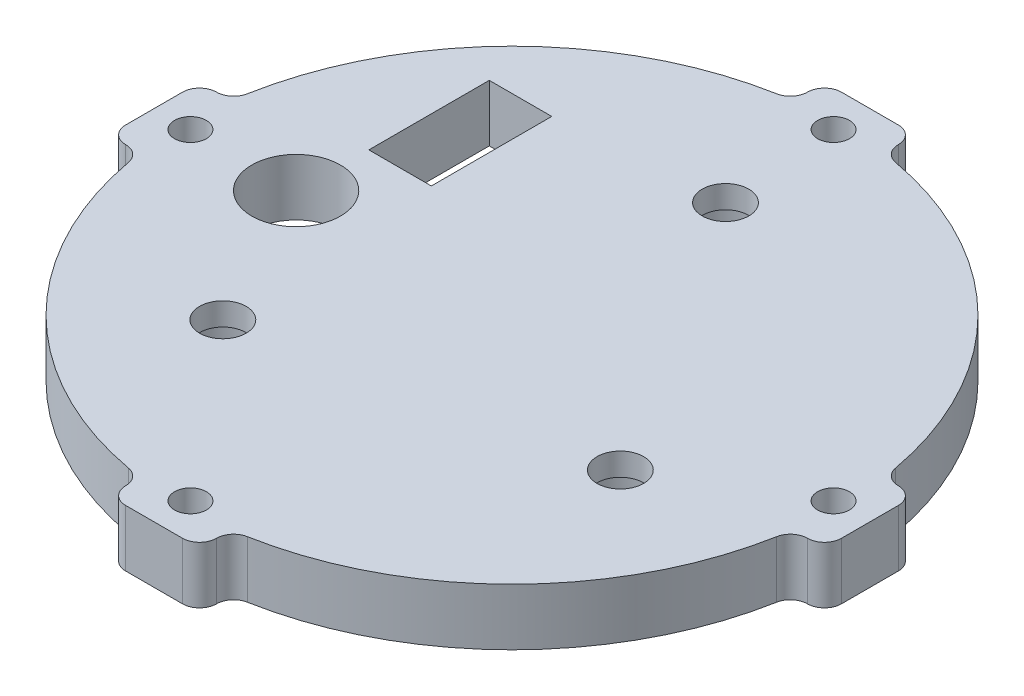
from build123d import *

# Parameters (mm, degrees)
SKETCH1_R                = 29
BOSS_EXTRUDE1_DEPTH      = 2.5
SKETCH3_W                = 8
SKETCH3_H                = 5
BOSS_EXTRUDE2_DEPTH      = 31.5
SKETCH5_R                = 1.4
CUT_EXTRUDE1_DEPTH       = 44.107423955
FILLET2_R                = 1.5
CIRPATTERN1_COUNT        = 4
FILLET2_OF_CIRPATTERN1_R = 1.5
SKETCH6_R                = 3.9
CUT_EXTRUDE2_DEPTH       = 45.827446949
SKETCH7_W                = 5.5
SKETCH7_H                = 10.6
CUT_EXTRUDE3_DEPTH       = 45.827446949
SKETCH8_R                = 2.05
CUT_EXTRUDE4_DEPTH       = 45.827446949
SKETCH9_R                = 3.75
CUT_EXTRUDE5_DEPTH       = 3


with BuildPart() as part:
    # Sketch1 → Boss-Extrude1 (new, symmetric)
    with BuildSketch(Plane(origin=(0, 0, 0), x_dir=(1, 0, 0), z_dir=(0, 1, 0))):
        with Locations(Location((0, 0, 0), (0, 0, 270))):
            Circle(SKETCH1_R)
    extrude(amount=BOSS_EXTRUDE1_DEPTH, both=True)

    # Sketch3 → Boss-Extrude2 (add)
    with BuildSketch(Plane.XY):
        Rectangle(SKETCH3_W, SKETCH3_H)
    boss_extrude2 = extrude(amount=BOSS_EXTRUDE2_DEPTH)

    # Sketch5 → Cut-Extrude1 (cut, through all)
    with BuildSketch(Plane(origin=(0, 2.5, 0), x_dir=(1, 0, 0), z_dir=(0, 1, 0))):
        with Locations(Location((0, -28.3, 0), (0, 0, 270))):
            Circle(SKETCH5_R)
    cut_extrude1 = extrude(amount=-CUT_EXTRUDE1_DEPTH, mode=Mode.SUBTRACT)

    # Fillet2
    fillet2_edges = [part.edges().sort_by_distance(p)[0] for p in [
        (4, 0, 28.722813233),
        (-4, 0, 28.722813233),
        (-4, 0, 31.5),
        (4, 0, 31.5),
    ]]
    fillet(fillet2_edges, radius=FILLET2_R - 0.0001)  # a hair under: the kernel refuses the full size

    # CirPattern1: Boss-Extrude2, Cut-Extrude1 ×4 about axis
    cirpattern1_axis = Axis((0, 0, 0), (0, 1, 0))
    add([boss_extrude2.rotate(cirpattern1_axis, i * 360 / CIRPATTERN1_COUNT) for i in range(1, CIRPATTERN1_COUNT)])
    add([cut_extrude1.rotate(cirpattern1_axis, i * 360 / CIRPATTERN1_COUNT) for i in range(1, CIRPATTERN1_COUNT)], mode=Mode.SUBTRACT)

    # Fillet2 of CirPattern1
    fillet2_of_cirpattern1_edges = [part.edges().sort_by_distance(p)[0] for p in [
        (28.722813233, 0, -4),
        (28.722813233, 0, 4),
        (31.5, 0, 4),
        (31.5, 0, -4),
        (-4, 0, -28.722813233),
        (4, 0, -28.722813233),
        (4, 0, -31.5),
        (-4, 0, -31.5),
        (-28.722813233, 0, 4),
        (-28.722813233, 0, -4),
        (-31.5, 0, -4),
        (-31.5, 0, 4),
    ]]
    fillet(fillet2_of_cirpattern1_edges, radius=FILLET2_OF_CIRPATTERN1_R - 0.0001)  # a hair under: the kernel refuses the full size

    # Sketch6 → Cut-Extrude2 (cut, through all)
    with BuildSketch(Plane(origin=(0, 2.5, 0), x_dir=(1, 0, 0), z_dir=(0, 1, 0))):
        with Locations(Location((-19, 0, 0), (0, 0, 270))):
            Circle(SKETCH6_R)
    extrude(amount=-CUT_EXTRUDE2_DEPTH, mode=Mode.SUBTRACT)

    # Sketch7 → Cut-Extrude3 (cut, through all)
    with BuildSketch(Plane(origin=(0, 2.5, 0), x_dir=(1, 0, 0), z_dir=(0, 1, 0))):
        with Locations((-16.15, 11.6)):
            Rectangle(SKETCH7_W, SKETCH7_H)
    extrude(amount=-CUT_EXTRUDE3_DEPTH, mode=Mode.SUBTRACT)

    # Sketch8 → Cut-Extrude4 (cut, through all)
    with BuildSketch(Plane.XZ.offset(2.5)):
        with Locations(Location((0.80857407, -17.981829939, 0), (0, 0, 270))):
            Circle(SKETCH8_R)
        with Locations(Location((16.569087362, 7.033160313, 0), (0, 0, 270))):
            Circle(SKETCH8_R)
        with Locations(Location((-12.373363213, 13.072868194, 0), (0, 0, 270))):
            Circle(SKETCH8_R)
    extrude(amount=-CUT_EXTRUDE4_DEPTH, mode=Mode.SUBTRACT)

    # Sketch9 → Cut-Extrude5 (cut)
    with BuildSketch(Plane(origin=(0, -2.5, 0), x_dir=(-1, 0, 0), z_dir=(0, -1, 0))):
        with Locations(Location((-0.80857407, 17.981829939, 0), (0, 0, 90))):
            Circle(SKETCH9_R)
        with Locations(Location((12.373363213, -13.072868194, 0), (0, 0, 90))):
            Circle(SKETCH9_R)
        with Locations(Location((-16.569087362, -7.033160313, 0), (0, 0, 90))):
            Circle(SKETCH9_R)
    extrude(amount=-CUT_EXTRUDE5_DEPTH, mode=Mode.SUBTRACT)


solid = part.part
